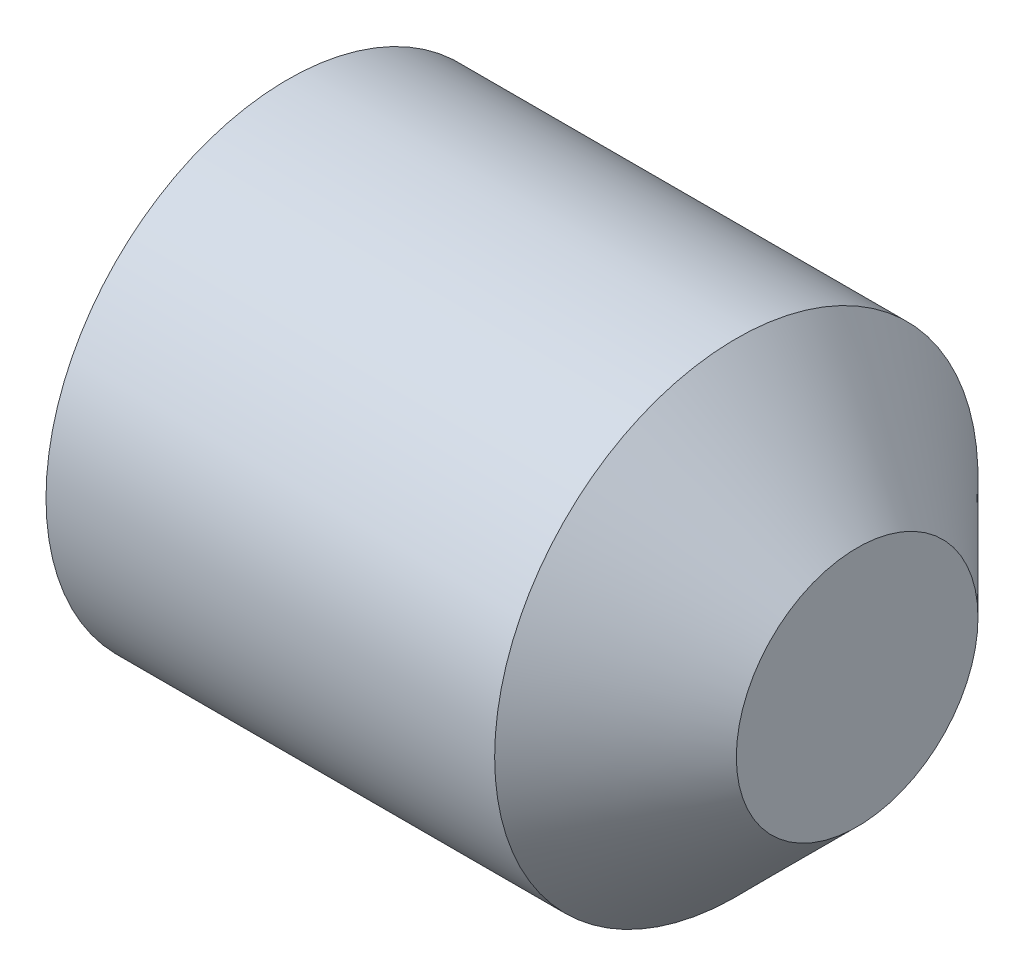
from build123d import *

# Parameters (mm, degrees)
HEXAGONSOCKET_DEPTH = 0.7


with BuildPart() as part:
    # BodySke → BaseBody (revolve)
    with BuildSketch(Plane.XY):
        Polygon((2, 0), (2, 0.4), (1.6, 0.8), (0, 0.8), (0, 0), align=None)
    revolve(axis=Axis((0, 0, 0), (1, 0, 0)))

    # HeadChamferSke → HeadChamfer (revolve, cut)
    with BuildSketch(Plane.XY):
        Polygon((0, 0.8), (0, 0.601), (0.114892704, 0.8), align=None)
    revolve(axis=Axis((0, 0, 0), (1, 0, 0)), mode=Mode.SUBTRACT)

    # HexagonSocketSke → HexagonSocket (cut)
    with BuildSketch(Plane.ZY):
        Polygon((0, 0.404145188), (-0.35, 0.202072594), (-0.35, -0.202072594), (0, -0.404145188), (0.35, -0.202072594), (0.35, 0.202072594), align=None)
    extrude(amount=-HEXAGONSOCKET_DEPTH, mode=Mode.SUBTRACT)


solid = part.part
